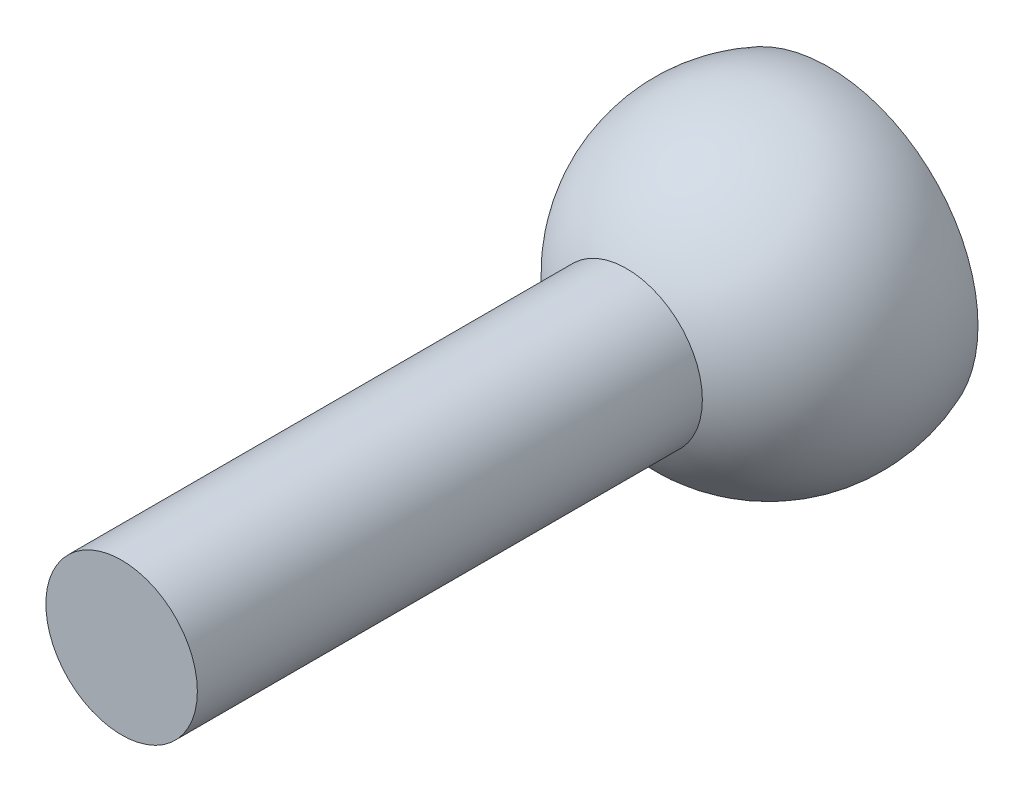
from build123d import *

# Parameters (mm, degrees)
SKETCH1_R           = 1.5
BOSS_EXTRUDE1_DEPTH = 10
SKETCH3_R           = 4
CUT_EXTRUDE2_DEPTH  = 6
SHELL11_T           = -0.5


# Read off the part's stored shape, not the designer's step: Dome1
with BuildPart() as part:
    # Sketch1 → Boss-Extrude1 (new body)
    with BuildSketch(Plane.XY):
        Circle(SKETCH1_R)
    extrude(amount=BOSS_EXTRUDE1_DEPTH)

    # Dome1 outline → Dome1 (revolve)
    with BuildSketch(Plane.XZ):
        with BuildLine():
            Line((0, 2e-09), (0, -6))
            ThreePointArc((0, -6), (3.09232922, -3.585582304), (1.499999999, 1e-09))
            Line((1.499999999, 1e-09), (0, 2e-09))
        make_face()
    revolve(axis=Axis((0, 0, 0), (0, 0, 1)))

    # Sketch3 → Cut-Extrude2 (cut)
    with BuildSketch(Plane.XY.offset(-10)):
        Circle(SKETCH3_R)
    extrude(amount=CUT_EXTRUDE2_DEPTH, mode=Mode.SUBTRACT)

    # Shell11
    shell11_openings = [part.faces().sort_by_distance(p)[0] for p in [
        (1e-09, 0, -4),
    ]]
    offset(amount=SHELL11_T, openings=shell11_openings, kind=Kind.INTERSECTION)


solid = part.part
